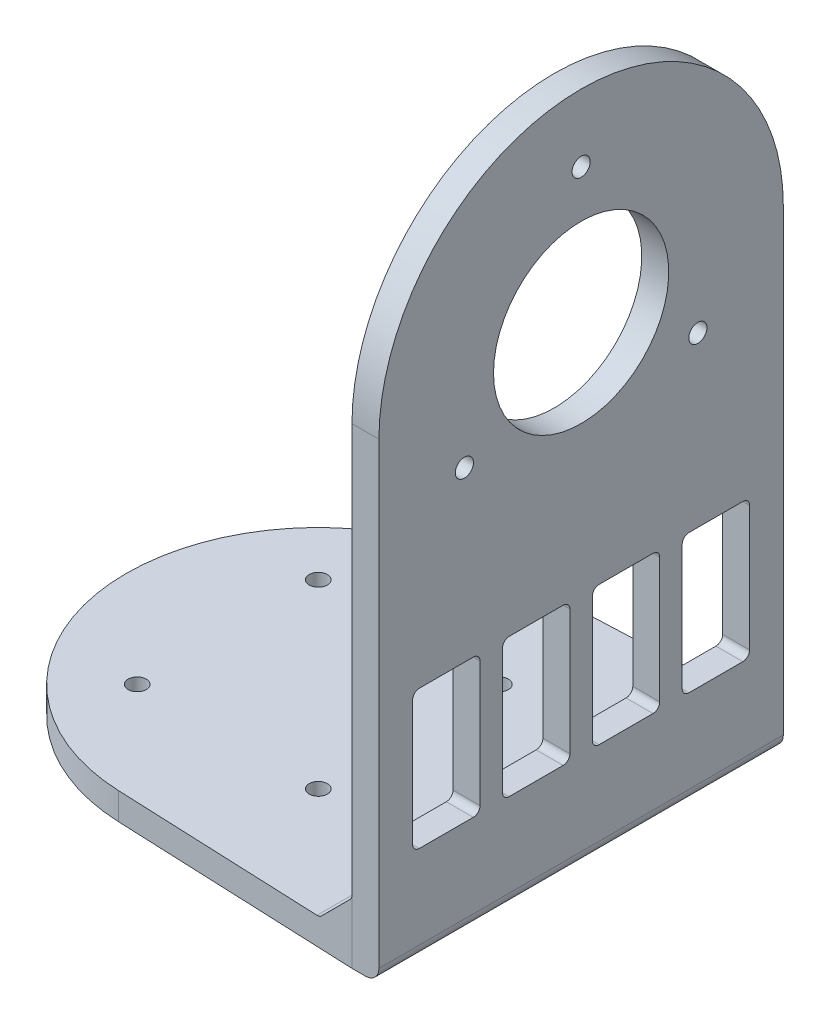
from build123d import *

# Parameters (mm, degrees)
EXTRUDE_1_DEPTH     = 4
EXTRUDE_2_DEPTH     = 4
SKETCH_4_R          = 1.35
SKETCH_4_R_2        = 13
CUT_EXTRUDE_1_DEPTH = 4
SKETCH_5_R          = 1.35
CUT_EXTRUDE_2_DEPTH = 4
EXTRUDE_3_REACH     = 124.967
FILLET_1_R          = 1
CUT_EXTRUDE_3_DEPTH = 4
FILLET_2_R          = 2


with BuildPart() as part:
    # 草图1 → 凸台-拉伸1 (new body)
    with BuildSketch(Plane(origin=(0, 0, 0), x_dir=(1, 0, 0), z_dir=(0, 1, 0))):
        with BuildLine():
            Line((-1.199773028, 28.474735199), (35, 30))
            Line((35, 30), (35, -30))
            Line((35, -30), (-1.199773028, -28.474735199))
            ThreePointArc((-1.199773028, -28.474735199), (-28.5, 0), (-1.199773028, 28.474735199))
        make_face()
    extrude(amount=EXTRUDE_1_DEPTH)

    # 草图3 → 凸台-拉伸2 (add)
    with BuildSketch(Plane(origin=(35, 0, 0), x_dir=(0, 0, -1), z_dir=(1, 0, 0))):
        with BuildLine():
            Line((-30, 0), (-30, 70))
            ThreePointArc((-30, 70), (0, 100), (30, 70))
            Line((30, 70), (30, 0))
            Line((30, 0), (-30, 0))
        make_face()
    extrude(amount=EXTRUDE_2_DEPTH)

    # 草图4 → 切除-拉伸1 (cut)
    with BuildSketch(Plane.ZY.offset(-35)):
        with Locations((0, 90)):
            Circle(SKETCH_4_R)
        with Locations((17.320508076, 60)):
            Circle(SKETCH_4_R)
        with Locations((-17.320508076, 60)):
            Circle(SKETCH_4_R)
        with Locations((0, 70)):
            Circle(SKETCH_4_R_2)
    extrude(amount=-CUT_EXTRUDE_1_DEPTH, mode=Mode.SUBTRACT)

    # 草图5 → 切除-拉伸2 (cut)
    with BuildSketch(Plane.XZ):
        with Locations(Location((-13.435028843, 13.435028843, 0), (0, 0, 270))):
            Circle(SKETCH_5_R)
        with Locations(Location((13.435028843, 13.435028843, 0), (0, 0, 270))):
            Circle(SKETCH_5_R)
        with Locations(Location((13.435028843, -13.435028843, 0), (0, 0, 270))):
            Circle(SKETCH_5_R)
        with Locations(Location((-13.435028843, -13.435028843, 0), (0, 0, 270))):
            Circle(SKETCH_5_R)
    extrude(amount=-CUT_EXTRUDE_2_DEPTH, mode=Mode.SUBTRACT)

    # 凸台-拉伸3: up to this plane
    extrude_3_end = Plane(origin=(35, 4, 30), z_dir=(0.04209729923272397, 0, -0.9991135157715116))
    # 草图6 → 凸台-拉伸3 (add, up to the surface)
    with BuildSketch(Plane(origin=(0, 0, -30), x_dir=(-1, 0, 0), z_dir=(0, 0, -1)), mode=Mode.PRIVATE) as extrude_3_sk1:
        Polygon((-35, 9), (-35, 4), (-30, 4), align=None)
    extrude_3_tool1 = split(extrude(extrude_3_sk1.sketch, amount=-EXTRUDE_3_REACH, mode=Mode.PRIVATE), bisect_by=extrude_3_end, keep=Keep.BOTH, mode=Mode.PRIVATE)
    add(extrude_3_tool1.solids().sort_by_distance((33.333333, 5.666667, -30))[0])

    # 圆角1
    # the kernel refuses this fillet: 1 mm, written as the material it adds along each edge
    with BuildSketch(Plane(origin=(35, 9, -30), x_dir=(-0.7071067811865455, -0.7071067811865497, 0), z_dir=(0, 0, 1))) as fillet_1_piece_1_section:
        with BuildLine():
            CenterArc((FILLET_1_R * 0.414213562373, -FILLET_1_R), FILLET_1_R, 90, 45)
            Line((-FILLET_1_R * 0.292893218813, -FILLET_1_R * 0.292893218813), (0, 0))
            Line((0, 0), (FILLET_1_R * 0.414213562373, 0))
        make_face()
    fillet_1_piece_1 = extrude(amount=61.035533906, mode=Mode.PRIVATE)
    fillet_1_piece_1 = split(fillet_1_piece_1, bisect_by=Plane(origin=(33.678090618, 9.024924819, 29.94430181), z_dir=(0.042097299232723984, 0, -0.9991135157715116)), keep=Keep.TOP, mode=Mode.PRIVATE)
    add(fillet_1_piece_1)
    with BuildSketch(Plane(origin=(30, 4, -30.824860651), x_dir=(0.7071067811865442, 0.7071067811865507, 0), z_dir=(0, 0, 1))) as fillet_1_piece_2_section:
        with BuildLine():
            CenterArc((FILLET_1_R * 0.414213562373, FILLET_1_R), FILLET_1_R, 225, 45)
            Line((-FILLET_1_R * 0.292893218813, FILLET_1_R * 0.292893218813), (0, 0))
            Line((0, 0), (FILLET_1_R * 0.414213562373, 0))
        make_face()
    fillet_1_piece_2 = extrude(amount=61.649721303, mode=Mode.PRIVATE)
    fillet_1_piece_2 = split(fillet_1_piece_2, bisect_by=Plane(origin=(28.722202674, 4.060172408, -29.735487201), z_dir=(0.042097299232723984, 0, 0.9991135157715116)), keep=Keep.TOP, mode=Mode.PRIVATE)
    fillet_1_piece_2 = split(fillet_1_piece_2, bisect_by=Plane(origin=(28.722202674, 4.060172408, 29.735487201), z_dir=(0.042097299232723984, 0, -0.9991135157715116)), keep=Keep.TOP, mode=Mode.PRIVATE)
    add(fillet_1_piece_2)

    # 草图7 → 切除-拉伸3 (cut)
    with BuildSketch(Plane.ZY.offset(-35)):
        with BuildLine():
            Line((-24, 35), (-16, 35))
            ThreePointArc((-16, 35), (-15.292893219, 34.707106781), (-15, 34))
            Line((-15, 34), (-15, 15.414213562))
            ThreePointArc((-15, 15.414213562), (-15.292893219, 14.707106781), (-16, 14.414213562))
            Line((-16, 14.414213562), (-24, 14.414213562))
            ThreePointArc((-24, 14.414213562), (-24.707106781, 14.707106781), (-25, 15.414213562))
            Line((-25, 15.414213562), (-25, 34))
            ThreePointArc((-25, 34), (-24.707106781, 34.707106781), (-24, 35))
        make_face()
        with BuildLine():
            Line((-11.666666667, 34), (-11.666666667, 15.414213562))
            ThreePointArc((-11.666666667, 15.414213562), (-11.373773448, 14.707106781), (-10.666666667, 14.414213562))
            Line((-10.666666667, 14.414213562), (-2.666666667, 14.414213562))
            ThreePointArc((-2.666666667, 14.414213562), (-1.959559885, 14.707106781), (-1.666666667, 15.414213562))
            Line((-1.666666667, 15.414213562), (-1.666666667, 34))
            ThreePointArc((-1.666666667, 34), (-1.959559885, 34.707106781), (-2.666666667, 35))
            Line((-2.666666667, 35), (-10.666666667, 35))
            ThreePointArc((-10.666666667, 35), (-11.373773448, 34.707106781), (-11.666666667, 34))
        make_face()
        with BuildLine():
            Line((1.666666667, 34), (1.666666667, 15.414213562))
            ThreePointArc((1.666666667, 15.414213562), (1.959559885, 14.707106781), (2.666666667, 14.414213562))
            Line((2.666666667, 14.414213562), (10.666666667, 14.414213562))
            ThreePointArc((10.666666667, 14.414213562), (11.373773448, 14.707106781), (11.666666667, 15.414213562))
            Line((11.666666667, 15.414213562), (11.666666667, 34))
            ThreePointArc((11.666666667, 34), (11.373773448, 34.707106781), (10.666666667, 35))
            Line((10.666666667, 35), (2.666666667, 35))
            ThreePointArc((2.666666667, 35), (1.959559885, 34.707106781), (1.666666667, 34))
        make_face()
        with BuildLine():
            Line((15, 34), (15, 15.414213562))
            ThreePointArc((15, 15.414213562), (15.292893219, 14.707106781), (16, 14.414213562))
            Line((16, 14.414213562), (24, 14.414213562))
            ThreePointArc((24, 14.414213562), (24.707106781, 14.707106781), (25, 15.414213562))
            Line((25, 15.414213562), (25, 34))
            ThreePointArc((25, 34), (24.707106781, 34.707106781), (24, 35))
            Line((24, 35), (16, 35))
            ThreePointArc((16, 35), (15.292893219, 34.707106781), (15, 34))
        make_face()
    extrude(amount=-CUT_EXTRUDE_3_DEPTH, mode=Mode.SUBTRACT)

    # 圆角2
    fillet_2_edges = [part.edges().sort_by_distance(p)[0] for p in [
        (39, 0, 0),
    ]]
    fillet(fillet_2_edges, radius=FILLET_2_R)


solid = part.part
